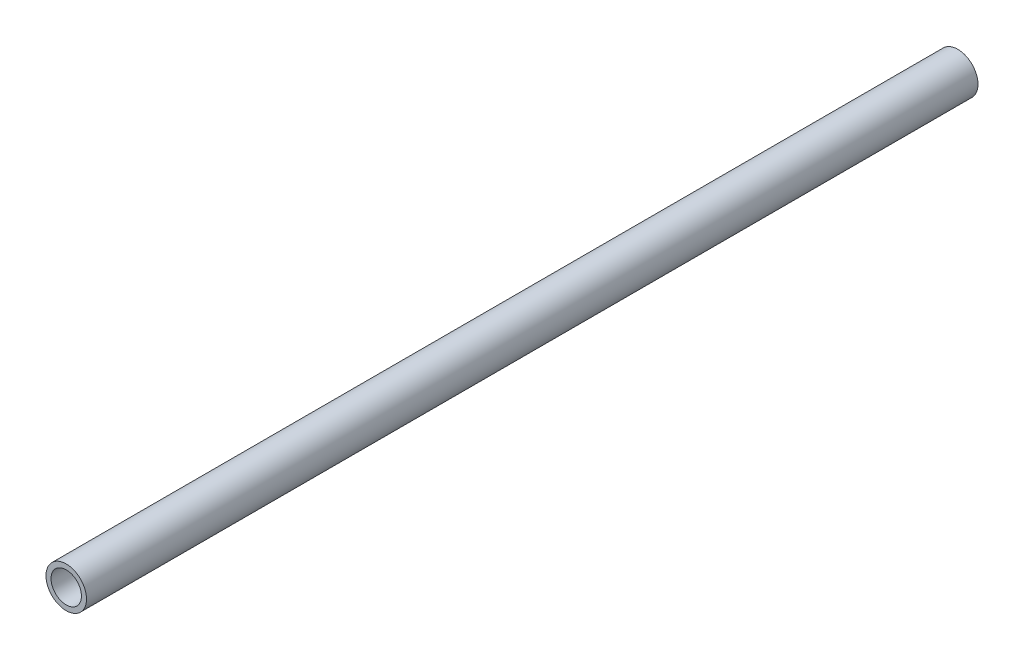
from build123d import *

# Parameters (mm, degrees)
SKETCH2_R           = 12.7
SKETCH2_R_2         = 9.525
BOSS_EXTRUDE1_DEPTH = 279.4


with BuildPart() as part:
    # Sketch2 → Boss-Extrude1 (new, symmetric)
    with BuildSketch(Plane.XY):
        Circle(SKETCH2_R)
        Circle(SKETCH2_R_2, mode=Mode.SUBTRACT)
    extrude(amount=BOSS_EXTRUDE1_DEPTH, both=True)


solid = part.part
